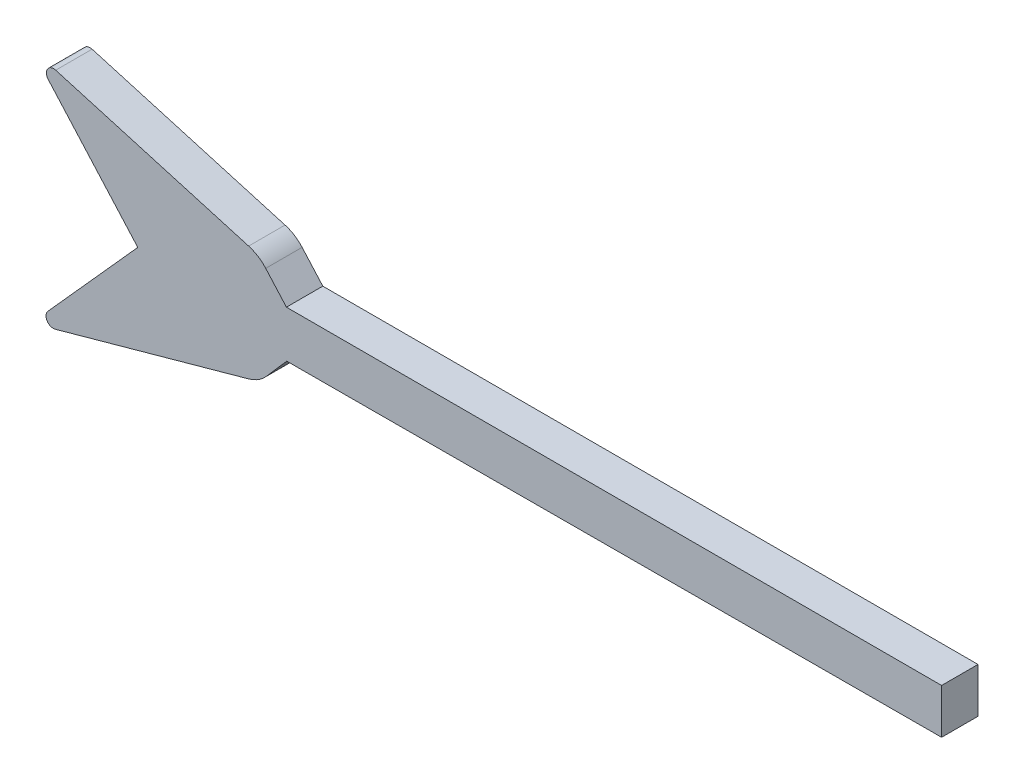
from build123d import *

# Parameters (mm, degrees)
BOSS_EXTRU_1_DEPTH = 10


with BuildPart() as part:
    # Esquisse1 → Boss.-Extru.1 (new body)
    with BuildSketch(Plane.XY):
        with BuildLine():
            Line((-23.646623539, -5.475599369), (-18.050841808, 0.926753128))
            Line((-18.050841808, 0.926753128), (161.856289633, 1.378648823))
            Line((161.856289633, 1.378648823), (161.856289633, 13.721731346))
            Line((161.856289633, 13.721731346), (-18.143710367, 13.721731346))
            Line((-18.143710367, 13.721731346), (-23.832360657, 20.114357067))
            ThreePointArc((-23.832360657, 20.114357067), (-25.968224675, 21.924872738), (-28.522312132, 23.072269514))
            Line((-28.522312132, 23.072269514), (-81.529598126, 38.415853733))
            ThreePointArc((-81.529598126, 38.415853733), (-83.77734848, 37.561631676), (-83.579778581, 35.165166965))
            Line((-83.579778581, 35.165166965), (-58.983064004, 7.524587521))
            Line((-58.983064004, 7.524587521), (-83.683817787, -20.023057796))
            ThreePointArc((-83.683817787, -20.023057796), (-83.894250032, -22.412614831), (-81.659847534, -23.285374839))
            Line((-81.659847534, -23.285374839), (-28.501505769, -8.530440884))
            ThreePointArc((-28.501505769, -8.530440884), (-25.85033223, -7.358585076), (-23.646623539, -5.475599369))
        make_face()
    extrude(amount=BOSS_EXTRU_1_DEPTH)


solid = part.part
